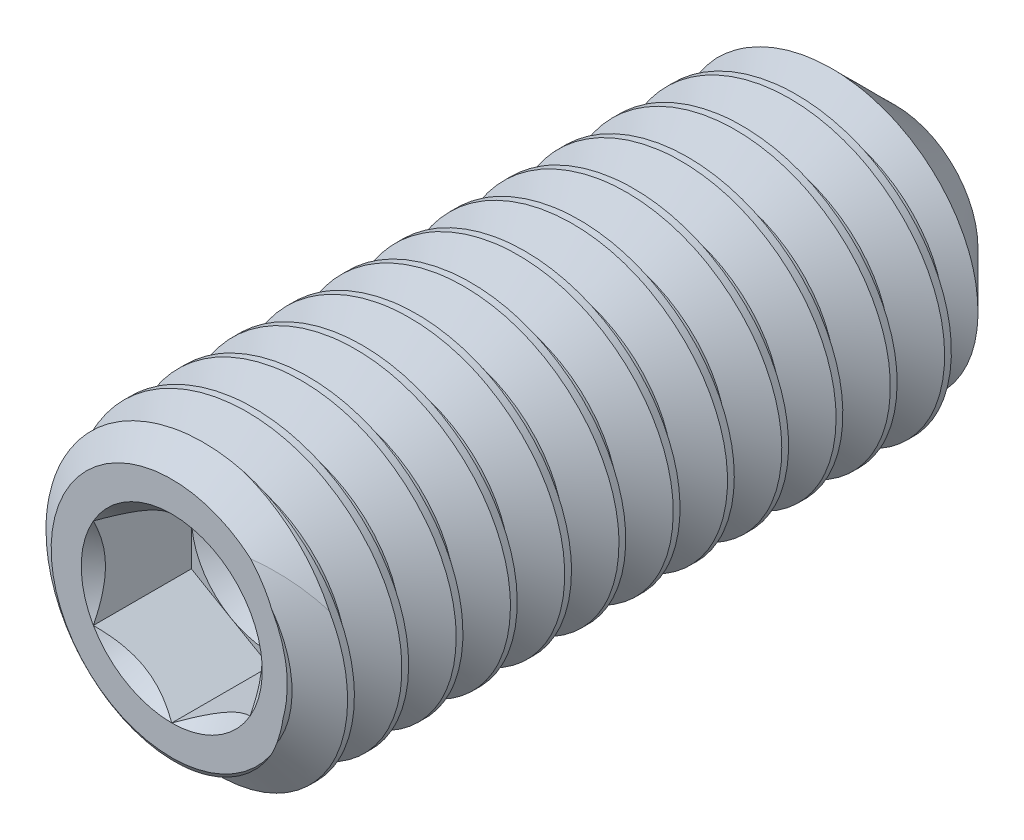
from build123d import *

# Parameters (mm, degrees)
CUT_SWEEP2_PITCH    = 0.45
CUT_EXTRUDE10_DEPTH = 0.8125


with BuildPart() as part:
    # Sketch22 → Revolve1 (revolve)
    with BuildSketch(Plane(origin=(0, 0, 0), x_dir=(0, 0, -1), z_dir=(1, 0, 0)), mode=Mode.PRIVATE) as revolve1_sk:
        Polygon((-2.794218417, 0), (-2.794218417, 1), (-2.619166532, 1.25), (2.640737716, 1.25), (3.205781583, 0.684956133), (2.794218417, 0), align=None)
    revolve(revolve1_sk.sketch.rotate(Axis((0, 0, -2.794218417), (0, 0, -1)), 180), axis=Axis((0, 0, -2.794218417), (0, 0, -1)))

    # Cut-Sweep2: arcs per turn and ends read off the stored shape
    # Cut-Sweep2: the profile of Sketch28 profile screwed along a right-hand helix through 14.333333 turns, 6 arcs to a turn; built about Z, then put on its axis
    cut_sweep2_z = Axis((0, 0, 0), (0, 0, 1))
    cut_sweep2_corners = [(1.2503, 2.18e-07, -0.112326782), (1.2503, 2.18e-07, -0.506423193), (0.957716426, 1.67e-07, -0.337499988), (0.957716426, 1.67e-07, -0.281249988)]
    with BuildLine(mode=Mode.PRIVATE) as cut_sweep2_profile:
        Line(cut_sweep2_corners[0], cut_sweep2_corners[1])
        Line(cut_sweep2_corners[1], cut_sweep2_corners[2])
        Line(cut_sweep2_corners[2], cut_sweep2_corners[3])
        Line(cut_sweep2_corners[3], cut_sweep2_corners[0])
    cut_sweep2_cap = Face(cut_sweep2_profile.wire())
    cut_sweep2_turn_angles = [0, 30, 60, 90, 120, 150, 180, 210, 240, 270, 300, 330, 360]
    cut_sweep2_turn_weights = [1, 0.8660254037844387, 1, 0.8660254037844387, 1, 0.8660254037844387, 1, 0.8660254037844387, 1, 0.8660254037844387, 1, 0.8660254037844387, 1]
    cut_sweep2_turn_rails = [Edge.make_bspline([Vector(p[0], p[1], 0).rotate(cut_sweep2_z, cut_sweep2_turn_angles[k]) / cut_sweep2_turn_weights[k] + Vector(0, 0, p[2] + CUT_SWEEP2_PITCH * cut_sweep2_turn_angles[k] / 360) for k in range(13)], [0, 0, 0, 1, 1, 2, 2, 3, 3, 4, 4, 5, 5, 6, 6, 6], 2, cut_sweep2_turn_weights) for p in cut_sweep2_corners]
    cut_sweep2_turn_sides = [Face.make_surface_from_curves(cut_sweep2_turn_rails[p[0]], cut_sweep2_turn_rails[p[1]]) for p in [(0, 1), (1, 2), (2, 3), (3, 0)]]
    cut_sweep2_last_angles = [5040, 5070, 5100, 5130, 5160]
    cut_sweep2_last_weights = [1, 0.8660254037844387, 1, 0.8660254037844466, 1]
    cut_sweep2_last_rails = [Edge.make_bspline([Vector(p[0], p[1], 0).rotate(cut_sweep2_z, cut_sweep2_last_angles[k]) / cut_sweep2_last_weights[k] + Vector(0, 0, p[2] + CUT_SWEEP2_PITCH * cut_sweep2_last_angles[k] / 360) for k in range(5)], [0, 0, 0, 1, 1, 2, 2, 2], 2, cut_sweep2_last_weights) for p in cut_sweep2_corners]
    cut_sweep2_last_sides = [Face.make_surface_from_curves(cut_sweep2_last_rails[p[0]], cut_sweep2_last_rails[p[1]]) for p in [(0, 1), (1, 2), (2, 3), (3, 0)]]
    cut_sweep2 = Plane(origin=(0, 0, -3.205781583), x_dir=(1, 0, 0), z_dir=(0, 0, 1)) * Solid(Shell([*[p.moved(Location((0, 0, CUT_SWEEP2_PITCH * i))) for i in range(14) for p in cut_sweep2_turn_sides], *cut_sweep2_last_sides, cut_sweep2_cap, cut_sweep2_cap.rotate(cut_sweep2_z, 5160).moved(Location((0, 0, CUT_SWEEP2_PITCH * 5160 / 360)))]))
    add(cut_sweep2, mode=Mode.SUBTRACT)

    # Sketch23 → Cut-Extrude10 (cut)
    with BuildSketch(Plane.XY.offset(2.794218417)):
        Polygon((0, 0.75055535), (-0.65, 0.375277675), (-0.65, -0.375277675), (0, -0.75055535), (0.65, -0.375277675), (0.65, 0.375277675), align=None)
    extrude(amount=-CUT_EXTRUDE10_DEPTH, mode=Mode.SUBTRACT)

    # Cut-Extrude11 cone 1 section (through the dimple's axis) → Cut-Extrude11 (revolve, cut)
    with BuildSketch(Plane(origin=(0, 0, 2.794218417), x_dir=(0, -1, 0), z_dir=(1, 0, 0))):
        Polygon((0, 0), (0.75055535, 0), (0, 0.75055535), align=None)
    revolve(axis=Axis((0, 0, 2.794218417), (0, 0, -1)), mode=Mode.SUBTRACT)

    # Cut-Extrude12 cone 1 section (through the dimple's axis) → Cut-Extrude12 (revolve, cut)
    with BuildSketch(Plane(origin=(0, 0, 1.981718417), x_dir=(0, -1, 0), z_dir=(1, 0, 0))):
        Polygon((0, 0), (0.65, 0), (0, 0.375277675), align=None)
    revolve(axis=Axis((0, 0, 1.981718417), (0, 0, -1)), mode=Mode.SUBTRACT)


solid = part.part
